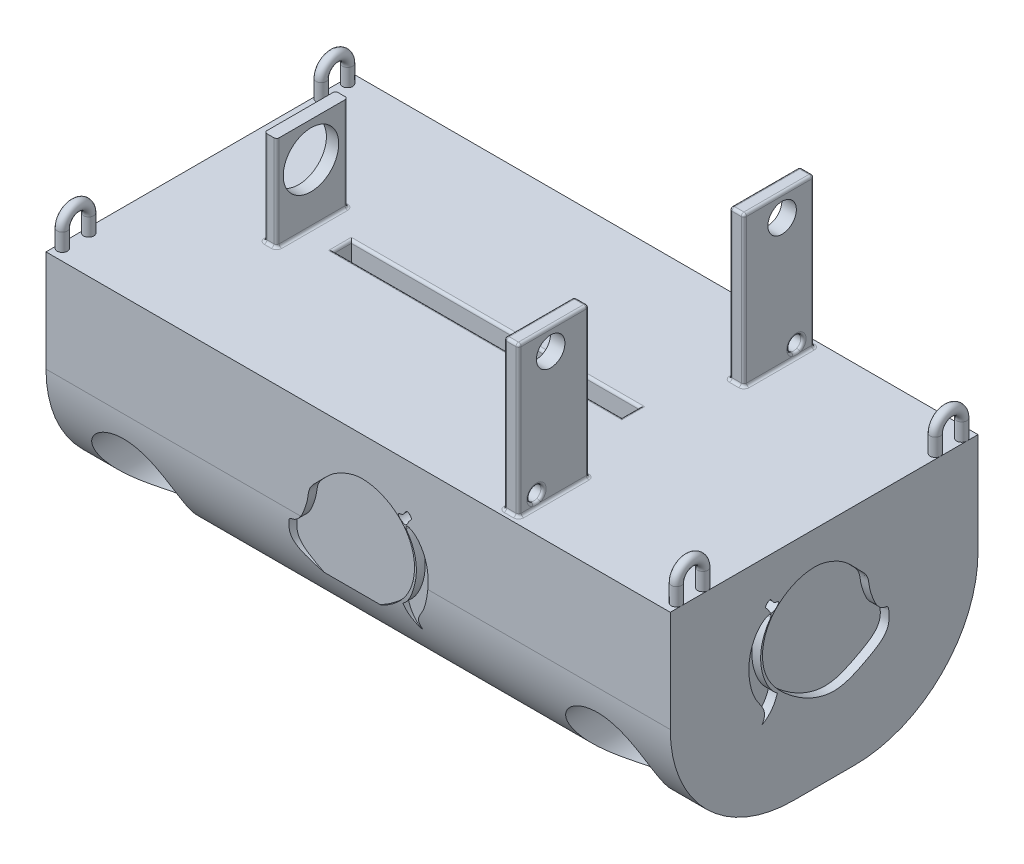
from build123d import *

# Parameters (mm, degrees)
SKETCH1_W               = 90.17
SKETCH1_H               = 32.444977511
BOSS_EXTRUDE1_DEPTH     = 44.45
SKETCH2_R               = 6.35
CUT_EXTRUDE1_DEPTH      = 44.45
SKETCH13_R              = 0.734226255
MIRROR4_COPY_1_SKETCH_R = 0.734226255
BOSS_EXTRUDE2_DEPTH     = 21.59
FILLET2_R               = 0.381
FILLET3_R               = 0.381
FILLET2_OF_MIRROR5_R    = 0.381
SKETCH16_W              = 41.612670953
SKETCH16_H              = 1.27
CUT_EXTRUDE2_DEPTH      = 49.53
FILLET4_R               = 0.381
SKETCH17_R              = 2.0574
CUT_EXTRUDE3_DEPTH      = 49.53
CUT_EXTRUDE4_DEPTH      = 49.53
FILLET5_R               = 0.381
FILLET8_R               = 0.381
SKETCH19_W              = 1.775635953
SKETCH19_H              = 5.142377129
BOSS_EXTRUDE3_DEPTH     = 21.59
FILLET9_R               = 0.381
SKETCH20_R              = 4.002791577
CUT_EXTRUDE5_DEPTH      = 69.85
SKETCH21_W              = 16.58799847
SKETCH21_H              = 8.845117823
CUT_EXTRUDE6_DEPTH      = 69.85
SKETCH22_W              = 7.62
SKETCH22_H              = 5.969
CUT_EXTRUDE7_DEPTH      = 3.81
CUT_EXTRUDE8_DEPTH      = 1.27
CUT_EXTRUDE9_DEPTH      = 1.27
FILLET10_START          = -32.174602699
FILLET10_DEPTH          = 90.17


with BuildPart() as part:
    # Sketch1 → Boss-Extrude1 (new body)
    with BuildSketch(Plane.XY):
        with Locations((12.910397301, -8.043650675)):
            Rectangle(SKETCH1_W, SKETCH1_H)
    extrude(amount=BOSS_EXTRUDE1_DEPTH)

    # Sketch2 → Cut-Extrude1 (cut)
    with BuildSketch(Plane(origin=(0, 0, 0), x_dir=(-1, 0, 0), z_dir=(0, 0, -1))):
        with Locations((-47.137806029, -16.29849078)):
            Circle(SKETCH2_R)
        with Locations((21.317011426, -16.29849078)):
            Circle(SKETCH2_R)
    extrude(amount=-CUT_EXTRUDE1_DEPTH, mode=Mode.SUBTRACT)

    # Sweep6: sweep along a path in Sketch4
    with BuildLine(Plane(origin=(57.995397301, 0, 0), x_dir=(0, 0, -1), z_dir=(1, 0, 0))) as sweep6_path:
        Line((-42.830868052, 8.178838081), (-42.830868052, 10.718838081))
        ThreePointArc((-42.830868052, 10.718838081), (-40.925868052, 12.623838081), (-39.020868052, 10.718838081))
        Line((-39.020868052, 10.718838081), (-39.020868052, 8.178838081))
    # Sketch13 → Sweep6 (sweep)
    with BuildSketch(Plane(origin=(0, 8.178838081, 0), x_dir=(1, 0, 0), z_dir=(0, 1, 0))):
        with Locations((57.261171047, -39.020868052)):
            Circle(SKETCH13_R)
    sweep6 = sweep(path=sweep6_path.line)

    # Mirror3: Sweep6 across plane
    add(sweep6.mirror(Plane(origin=(12.910397301, 0, 0), x_dir=(0, 0, 1), z_dir=(1, 0, 0))))

    # Mirror4: Sweep6 across plane
    add(sweep6.mirror(Plane.XY.offset(22.225)))

    # Mirror4 copy 1: sweep along a path in Mirror4 copy 1 path
    with BuildLine(Plane(origin=(-32.174602699, 0, 44.45), x_dir=(0, 0, 1), z_dir=(-1, 0, 0))) as mirror4_copy_1_path:
        Line((-42.830868052, 8.178838081), (-42.830868052, 10.718838081))
        ThreePointArc((-42.830868052, 10.718838081), (-40.925868052, 12.623838081), (-39.020868052, 10.718838081))
        Line((-39.020868052, 10.718838081), (-39.020868052, 8.178838081))
    # Mirror4 copy 1 sketch → Mirror4 copy 1 (sweep)
    with BuildSketch(Plane(origin=(25.820794603, 8.178838081, 44.45), x_dir=(-1, 0, 0), z_dir=(0, 1, 0))):
        with Locations((57.261171047, -39.020868052)):
            Circle(MIRROR4_COPY_1_SKETCH_R)
    sweep(path=mirror4_copy_1_path.line)

    # Sketch15 → Boss-Extrude2 (add)
    with BuildSketch(Plane(origin=(0, 8.178838081, 0), x_dir=(1, 0, 0), z_dir=(0, 1, 0))):
        Polygon((35.211510916, -33.419626325), (34.957510916, -33.419626325), (33.372407819, -33.419626325), (33.118407819, -33.419626325), (33.118407819, -33.673626325), (33.118407819, -43.325626325), (33.118407819, -43.579626325), (33.372407819, -43.579626325), (34.957510916, -43.579626325), (35.211510916, -43.579626325), (35.211510916, -43.325626325), (35.211510916, -33.673626325), align=None)
    boss_extrude2 = extrude(amount=BOSS_EXTRUDE2_DEPTH)

    # Fillet2
    fillet2_edges = [part.edges().sort_by_distance(p)[0] for p in [
        (33.118407819, 18.973838081, 43.579626325),
        (35.211510916, 18.973838081, 43.579626325),
        (34.164959367, 29.768838081, 33.419626325),
        (35.211510916, 18.973838081, 33.419626325),
        (33.118407819, 18.973838081, 33.419626325),
        (34.164959367, 29.768838081, 43.579626325),
        (35.211510916, 29.768838081, 38.499626325),
        (33.118407819, 29.768838081, 38.499626325),
    ]]
    fillet(fillet2_edges, radius=FILLET2_R)

    # Fillet3
    fillet3_edges = [part.edges().sort_by_distance(p)[0] for p in [
        (34.164959367, 8.178838081, 33.419626325),
        (34.164959367, 8.178838081, 43.579626325),
        (33.118407819, 8.178838081, 38.499626325),
        (35.211510916, 8.178838081, 38.499626325),
        (33.230000135, 8.178838081, 43.468034009),
        (35.099918599, 8.178838081, 43.468034009),
        (35.099918599, 8.178838081, 33.531218642),
        (33.230000135, 8.178838081, 33.531218642),
    ]]
    fillet(fillet3_edges, radius=FILLET3_R)

    # Mirror5: Boss-Extrude2 across plane
    add(boss_extrude2.mirror(Plane.XY.offset(22.225)))

    # Fillet2 of Mirror5
    fillet2_of_mirror5_edges = [part.edges().sort_by_distance(p)[0] for p in [
        (33.118407819, 18.973838081, 0.870373675),
        (35.211510916, 18.973838081, 0.870373675),
        (34.164959367, 29.768838081, 11.030373675),
        (35.211510916, 18.973838081, 11.030373675),
        (33.118407819, 18.973838081, 11.030373675),
        (34.164959367, 29.768838081, 0.870373675),
        (35.211510916, 29.768838081, 5.950373675),
        (33.118407819, 29.768838081, 5.950373675),
    ]]
    fillet(fillet2_of_mirror5_edges, radius=FILLET2_OF_MIRROR5_R)

    # Sketch16 → Cut-Extrude2 (cut)
    with BuildSketch(Plane(origin=(0, 8.178838081, 0), x_dir=(1, 0, 0), z_dir=(0, 1, 0))):
        with Locations((9.237757914, -21.59)):
            Rectangle(SKETCH16_W, SKETCH16_H)
        with Locations((9.237757914, -22.86)):
            Rectangle(SKETCH16_W, SKETCH16_H)
    extrude(amount=-CUT_EXTRUDE2_DEPTH, mode=Mode.SUBTRACT)

    # Fillet4
    fillet4_edges = [part.edges().sort_by_distance(p)[0] for p in [
        (34.164959367, 8.178838081, 11.030373675),
        (34.164959367, 8.178838081, 0.870373675),
        (33.118407819, 8.178838081, 5.950373675),
        (35.211510916, 8.178838081, 5.950373675),
        (33.230000135, 8.178838081, 0.981965991),
        (35.099918599, 8.178838081, 0.981965991),
        (35.099918599, 8.178838081, 10.918781358),
        (33.230000135, 8.178838081, 10.918781358),
    ]]
    fillet(fillet4_edges, radius=FILLET4_R)

    # Sketch17 → Cut-Extrude3 (cut)
    with BuildSketch(Plane(origin=(35.211510916, 0, 0), x_dir=(0, 0, -1), z_dir=(1, 0, 0))):
        with Locations((-5.5118, 26.67)):
            Circle(SKETCH17_R)
        with Locations((-38.9382, 26.67)):
            Circle(SKETCH17_R)
    extrude(amount=-CUT_EXTRUDE3_DEPTH, mode=Mode.SUBTRACT)

    # Sketch18 → Cut-Extrude4 (cut)
    with BuildSketch(Plane(origin=(35.211510916, 0, 0), x_dir=(0, 0, -1), z_dir=(1, 0, 0))):
        with BuildLine():
            ThreePointArc((-39.97756052, 9.826504201), (-40.9948783, 10.843821981), (-42.01219608, 9.826504201))
            Line((-42.01219608, 9.826504201), (-39.97756052, 9.826504201))
        make_face()
        with BuildLine():
            Line((-39.97756052, 9.826504201), (-42.01219608, 9.826504201))
            ThreePointArc((-42.01219608, 9.826504201), (-40.9948783, 8.80918642), (-39.97756052, 9.826504201))
        make_face()
        with BuildLine():
            ThreePointArc((-2.43780392, 9.826504201), (-3.4551217, 10.843821981), (-4.47243948, 9.826504201))
            Line((-4.47243948, 9.826504201), (-2.43780392, 9.826504201))
        make_face()
        with BuildLine():
            Line((-2.43780392, 9.826504201), (-4.47243948, 9.826504201))
            ThreePointArc((-4.47243948, 9.826504201), (-3.4551217, 8.80918642), (-2.43780392, 9.826504201))
        make_face()
    extrude(amount=-CUT_EXTRUDE4_DEPTH, mode=Mode.SUBTRACT)

    # Fillet5
    fillet5_edges = [part.edges().sort_by_distance(p)[0] for p in [
        (35.211510916, 9.826504201, 42.01219608),
        (33.118407819, 9.826504201, 42.01219608),
        (33.118407819, 9.826504201, 4.47243948),
        (35.211510916, 9.826504201, 4.47243948),
    ]]
    fillet(fillet5_edges, radius=FILLET5_R)

    # Fillet8
    fillet8_edges = [part.edges().sort_by_distance(p)[0] for p in [
        (9.237757914, -24.26613943, 20.955),
        (-11.568577562, -24.26613943, 22.225),
        (9.237757914, -24.26613943, 23.495),
        (30.044093391, -24.26613943, 22.225),
        (30.044093391, 8.178838081, 22.225),
        (9.237757914, 8.178838081, 23.495),
        (-11.568577562, 8.178838081, 22.225),
        (9.237757914, 8.178838081, 20.955),
    ]]
    fillet(fillet8_edges, radius=FILLET8_R)

    # Sketch19 → Boss-Extrude3 (add)
    with BuildSketch(Plane(origin=(0, 8.178838081, 0), x_dir=(1, 0, 0), z_dir=(0, 1, 0))):
        with Locations((-16.843961132, -19.653811436)):
            Rectangle(SKETCH19_W, SKETCH19_H)
        with Locations((-16.843961132, -24.796188564)):
            Rectangle(SKETCH19_W, SKETCH19_H)
    extrude(amount=BOSS_EXTRUDE3_DEPTH)

    # Fillet9
    fillet9_edges = [part.edges().sort_by_distance(p)[0] for p in [
        (-15.956143155, 18.973838081, 27.367377129),
        (-16.843961131, 8.178838081, 17.082622871),
        (-15.956143155, 18.973838081, 17.082622871),
        (-17.731779108, 18.973838081, 17.082622871),
        (-17.731779108, 18.973838081, 27.367377129),
        (-15.956143155, 8.178838081, 22.225),
        (-16.843961131, 8.178838081, 27.367377129),
        (-17.731779108, 8.178838081, 22.225),
    ]]
    fillet(fillet9_edges, radius=FILLET9_R)

    # Sketch20 → Cut-Extrude5 (cut)
    with BuildSketch(Plane.ZY.offset(-33.118407819)):
        with Locations(Location((22.392278348, 16.778991577, 0), (0, 0, 180))):
            Circle(SKETCH20_R)
    extrude(amount=CUT_EXTRUDE5_DEPTH, mode=Mode.SUBTRACT)

    # Sketch21 → Cut-Extrude6 (cut)
    with BuildSketch(Plane.ZY.offset(17.731779108)):
        with Locations((22.49765526, 26.253369208)):
            Rectangle(SKETCH21_W, SKETCH21_H)
    extrude(amount=-CUT_EXTRUDE6_DEPTH, mode=Mode.SUBTRACT)

    # Sketch22 → Cut-Extrude7 (cut)
    with BuildSketch(Plane.XZ.offset(24.26613943)):
        with Locations((16.720397301, 17.5895)):
            Rectangle(SKETCH22_W, SKETCH22_H)
        with Locations((9.100397301, 17.5895)):
            Rectangle(SKETCH22_W, SKETCH22_H)
        with Locations((9.100397301, 26.8605)):
            Rectangle(SKETCH22_W, SKETCH22_H)
        with Locations((16.720397301, 26.8605)):
            Rectangle(SKETCH22_W, SKETCH22_H)
    extrude(amount=-CUT_EXTRUDE7_DEPTH, mode=Mode.SUBTRACT)

    # Sketch24 → Cut-Extrude8 (cut)
    with BuildSketch(Plane.XY.offset(44.45)):
        with BuildLine():
            add(Edge.make_bspline(
                [(9.52853405, 1.311160013), (8.632134681, 0.712247983), (7.488603125, -0.614747171), (5.770771683, -2.18801848), (5.652577676, -3.844234533), (5.130676767, -5.599296804), (4.335851174, -7.34607765), (2.863275897, -7.533084225), (2.746050807, -8.732019833), (2.758702087, -10.908431459), (6.214177407, -12.875849396), (11.012905032, -15.188727609), (17.159360183, -12.193585715), (21.651783136, -7.003883044), (20.587747238, 0.641888185), (14.361191047, 3.366917643), (10.83987103, 2.042149291), (9.930863866, 1.579968956), (9.52853405, 1.311160013)],
                knots=[0, 0, 0, 0, 0.061315996, 0.098937224, 0.124606676, 0.150681516, 0.206165582, 0.212472964, 0.228097872, 0.261143905, 0.337399243, 0.420477368, 0.559500504, 0.677874002, 0.788618197, 0.94316321, 0.972479618, 1, 1, 1, 1], degree=3))
        make_face()
        with BuildLine():
            add(Edge.make_bspline(
                [(18.732430736, 0.896537224), (18.819181464, 0.993114519), (19.570763654, 0.952924197), (19.814281148, 2.209247528), (20.859260743, 1.146378943), (20.117718461, 0.677103033), (19.895623057, -0.568154409), (18.542415327, 0.684998087), (18.732430736, 0.896537224)],
                knots=[0, 0, 0, 0, 0.118390752, 0.301312413, 0.472444194, 0.567086905, 0.740681517, 1, 1, 1, 1], degree=3))
        make_face()
        with BuildLine():
            add(Edge.make_bspline(
                [(18.907045378, -10.441081412), (19.489593579, -12.381720474), (21.144041731, -13.33417772)],
                knots=[0, 0, 0, 1, 1, 1], degree=2))
            add(Edge.make_bspline(
                [(19.991743985, 0), (20.869878201, -0.216881578), (22.26898883, -1.596035285), (23.1224145, -4.34675345), (22.98797558, -7.319448061), (21.958776683, -10.330643606), (20.237972709, -11.92216119), (21.144041731, -13.33417772)],
                knots=[0, 0, 0, 0, 0.176751024, 0.37248552, 0.562263371, 0.767012318, 1, 1, 1, 1], degree=3))
            add(Edge.make_bspline(
                [(19.860356865, -0.501998223), (19.717895519, -0.205921851), (19.991743985, 0)],
                knots=[0, 0, 0, 1, 1, 1], degree=2))
            add(Edge.make_bspline(
                [(18.907045378, -10.441081412), (19.684346477, -9.899534524), (21.700949973, -6.773449574), (21.64238765, -2.884083042), (19.860356865, -0.501998223)],
                knots=[0, 0, 0, 0, 0.260709978, 1, 1, 1, 1], degree=3))
        make_face()
    cut_extrude8 = extrude(amount=-CUT_EXTRUDE8_DEPTH, mode=Mode.SUBTRACT)

    # Mirror6: Cut-Extrude8 across plane
    add(cut_extrude8.mirror(Plane.XY.offset(22.225)), mode=Mode.SUBTRACT)

    # Sketch25 → Cut-Extrude9 (cut)
    with BuildSketch(Plane.ZY.offset(32.174602699)):
        with BuildLine():
            add(Edge.make_bspline(
                [(19.601898453, 2.090205417), (18.705499083, 1.491293387), (17.561967528, 0.164298233), (15.844136085, -1.408973076), (15.725942079, -3.065189129), (15.20404117, -4.820251401), (14.409215577, -6.567032246), (12.9366403, -6.754038822), (12.81941521, -7.952974429), (12.83206649, -10.129386055), (16.28754181, -12.096803992), (21.086269435, -14.409682205), (27.232724586, -11.414540311), (31.725147539, -6.22483764), (30.66111164, 1.420933589), (24.43455545, 4.145963047), (20.913235432, 2.821194694), (20.004228269, 2.35901436), (19.601898453, 2.090205417)],
                knots=[0, 0, 0, 0, 0.061315996, 0.098937224, 0.124606676, 0.150681516, 0.206165582, 0.212472964, 0.228097872, 0.261143905, 0.337399243, 0.420477368, 0.559500504, 0.677874002, 0.788618197, 0.94316321, 0.972479618, 1, 1, 1, 1], degree=3))
        make_face()
        with BuildLine():
            add(Edge.make_bspline(
                [(28.805795139, 1.675582628), (28.892545867, 1.772159923), (29.644128057, 1.731969601), (29.887645551, 2.988292932), (30.932625145, 1.925424347), (30.191082864, 1.456148437), (29.96898746, 0.210890995), (28.61577973, 1.46404349), (28.805795139, 1.675582628)],
                knots=[0, 0, 0, 0, 0.118390752, 0.301312413, 0.472444194, 0.567086905, 0.740681517, 1, 1, 1, 1], degree=3))
        make_face()
        with BuildLine():
            add(Edge.make_bspline(
                [(28.980409781, -9.662036008), (29.562957982, -11.60267507), (31.217406134, -12.555132316)],
                knots=[0, 0, 0, 1, 1, 1], degree=2))
            add(Edge.make_bspline(
                [(30.065108387, 0.779045404), (30.943242604, 0.562163826), (32.342353233, -0.816989881), (33.195778903, -3.567708046), (33.061339983, -6.540402657), (32.032141085, -9.551598202), (30.311337112, -11.143115786), (31.217406134, -12.555132316)],
                knots=[0, 0, 0, 0, 0.176751024, 0.37248552, 0.562263371, 0.767012318, 1, 1, 1, 1], degree=3))
            add(Edge.make_bspline(
                [(29.933721268, 0.277047181), (29.791259922, 0.573123553), (30.065108387, 0.779045404)],
                knots=[0, 0, 0, 1, 1, 1], degree=2))
            add(Edge.make_bspline(
                [(28.980409781, -9.662036008), (29.75771088, -9.12048912), (31.774314376, -5.99440417), (31.715752053, -2.105037638), (29.933721268, 0.277047181)],
                knots=[0, 0, 0, 0, 0.260709978, 1, 1, 1, 1], degree=3))
        make_face()
    cut_extrude9 = extrude(amount=-CUT_EXTRUDE9_DEPTH, mode=Mode.SUBTRACT)

    # Mirror7: Cut-Extrude9 across plane
    add(cut_extrude9.mirror(Plane(origin=(12.910397301, 0, 0), x_dir=(0, 0, 1), z_dir=(1, 0, 0))), mode=Mode.SUBTRACT)

    # Fillet10: read off the stored shape, not the designer's step
    # Fillet10 outline → Fillet10 (cut)
    with BuildSketch(Plane.YZ.offset(FILLET10_START)):
        with BuildLine():
            Line((-24.26613943, 0), (-6.48613943, 0))
            ThreePointArc((-6.48613943, 0), (-9.846243596, 0.320386602), (-13.085253008, 1.27))
            ThreePointArc((-13.085253008, 1.27), (-21.207902902, 7.81014141), (-24.26613943, 17.78))
            Line((-24.26613943, 17.78), (-24.26613943, 0))
        make_face()
        with BuildLine():
            Line((-24.26613943, 44.45), (-24.26613943, 26.67))
            ThreePointArc((-24.26613943, 26.67), (-21.207902901, 36.63985859), (-13.085253007, 43.18))
            ThreePointArc((-13.085253007, 43.18), (-9.846243543, 44.129613408), (-6.486139324, 44.45))
            Line((-6.486139324, 44.45), (-24.26613943, 44.45))
        make_face()
    extrude(amount=FILLET10_DEPTH, mode=Mode.SUBTRACT)


solid = part.part
